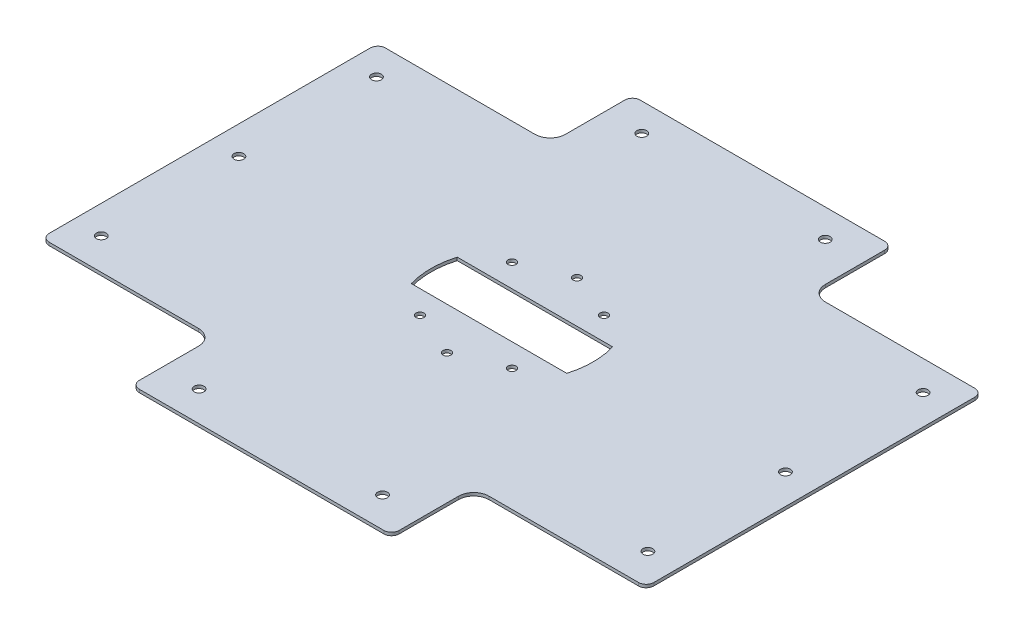
from build123d import *

# Parameters (mm, degrees)
SKETCH_1_R          = 3.2
EXTRUDE_1_DEPTH     = 2
SKETCH_4_R          = 2.6
CUT_EXTRUDE_1_DEPTH = 257.804736208
CUT_EXTRUDE_2_DEPTH = 257.804736208


with BuildPart() as part:
    # Эскиз1 → Бобышка-Вытянуть1 (new body)
    with BuildSketch(Plane(origin=(0, 0, 0), x_dir=(1, 0, 0), z_dir=(0, 1, 0))):
        with BuildLine():
            ThreePointArc((-85, -158.805454142), (-83.535533906, -162.340988048), (-80, -163.805454142))
            Line((-80, -163.805454142), (80, -163.805454142))
            ThreePointArc((80, -163.805454142), (83.535533906, -162.340988048), (85, -158.805454142))
            Line((85, -158.805454142), (85, -120))
            ThreePointArc((85, -120), (87.928932188, -112.928932188), (95, -110))
            Line((95, -110), (192.768667216, -110))
            ThreePointArc((192.768667216, -110), (196.304201122, -108.535533906), (197.768667216, -105))
            Line((197.768667216, -105), (197.768667216, 105))
            ThreePointArc((197.768667216, 105), (196.304201122, 108.535533906), (192.768667216, 110))
            Line((192.768667216, 110), (95, 110))
            ThreePointArc((95, 110), (87.928932188, 112.928932188), (85, 120))
            Line((85, 120), (85, 158.805454142))
            ThreePointArc((85, 158.805454142), (83.535533906, 162.340988048), (80, 163.805454142))
            Line((80, 163.805454142), (-80, 163.805454142))
            ThreePointArc((-80, 163.805454142), (-83.535533906, 162.340988048), (-85, 158.805454142))
            Line((-85, 158.805454142), (-85, 120))
            ThreePointArc((-85, 120), (-87.928932188, 112.928932188), (-95, 110))
            Line((-95, 110), (-192.768667216, 110))
            ThreePointArc((-192.768667216, 110), (-196.304201122, 108.535533906), (-197.768667216, 105))
            Line((-197.768667216, 105), (-197.768667216, -105))
            ThreePointArc((-197.768667216, -105), (-196.304201122, -108.535533906), (-192.768667216, -110))
            Line((-192.768667216, -110), (-95, -110))
            ThreePointArc((-95, -110), (-87.928932188, -112.928932188), (-85, -120))
            Line((-85, -120), (-85, -158.805454142))
        make_face()
        with Locations((-60.544692415, -144.14859292)):
            Circle(SKETCH_1_R, mode=Mode.SUBTRACT)
        with Locations((59.455307585, -144.14859292)):
            Circle(SKETCH_1_R, mode=Mode.SUBTRACT)
        with Locations((-60.544692415, 145.462315364)):
            Circle(SKETCH_1_R, mode=Mode.SUBTRACT)
        with Locations((59.455307585, 145.462315364)):
            Circle(SKETCH_1_R, mode=Mode.SUBTRACT)
        with Locations((-179.313359631, 0.656861222)):
            Circle(SKETCH_1_R, mode=Mode.SUBTRACT)
        with Locations((-179.313359631, 90.656861222)):
            Circle(SKETCH_1_R, mode=Mode.SUBTRACT)
        with Locations((-179.313359631, -89.343138778)):
            Circle(SKETCH_1_R, mode=Mode.SUBTRACT)
        with Locations((178.223974801, 0.656861222)):
            Circle(SKETCH_1_R, mode=Mode.SUBTRACT)
        with Locations((178.223974801, 90.656861222)):
            Circle(SKETCH_1_R, mode=Mode.SUBTRACT)
        with Locations((178.223974801, -89.343138778)):
            Circle(SKETCH_1_R, mode=Mode.SUBTRACT)
    extrude(amount=EXTRUDE_1_DEPTH)

    # Эскиз4 → Вырез-Вытянуть1 (cut, through all)
    with BuildSketch(Plane(origin=(0, 2, 0), x_dir=(1, 0, 0), z_dir=(0, 1, 0))):
        with Locations((0, 42.54)):
            Circle(SKETCH_4_R)
        with Locations((0, -42.54)):
            Circle(SKETCH_4_R)
        with Locations((30.080322472, 30.080322472)):
            Circle(SKETCH_4_R)
        with Locations((-30.080322472, -30.080322472)):
            Circle(SKETCH_4_R)
        with Locations((-30.080322472, 30.080322472)):
            Circle(SKETCH_4_R)
        with Locations((30.080322472, -30.080322472)):
            Circle(SKETCH_4_R)
    extrude(amount=-CUT_EXTRUDE_1_DEPTH, mode=Mode.SUBTRACT)

    # Эскиз5 → Вырез-Вытянуть2 (cut, through all)
    with BuildSketch(Plane.XZ):
        with BuildLine():
            Line((50.833060109, -15), (-50.833060109, -15))
            ThreePointArc((-50.833060109, -15), (-53, 0), (-50.833060109, 15))
            Line((-50.833060109, 15), (50.833060109, 15))
            ThreePointArc((50.833060109, 15), (53, 0), (50.833060109, -15))
        make_face()
    extrude(amount=-CUT_EXTRUDE_2_DEPTH, mode=Mode.SUBTRACT)


solid = part.part
